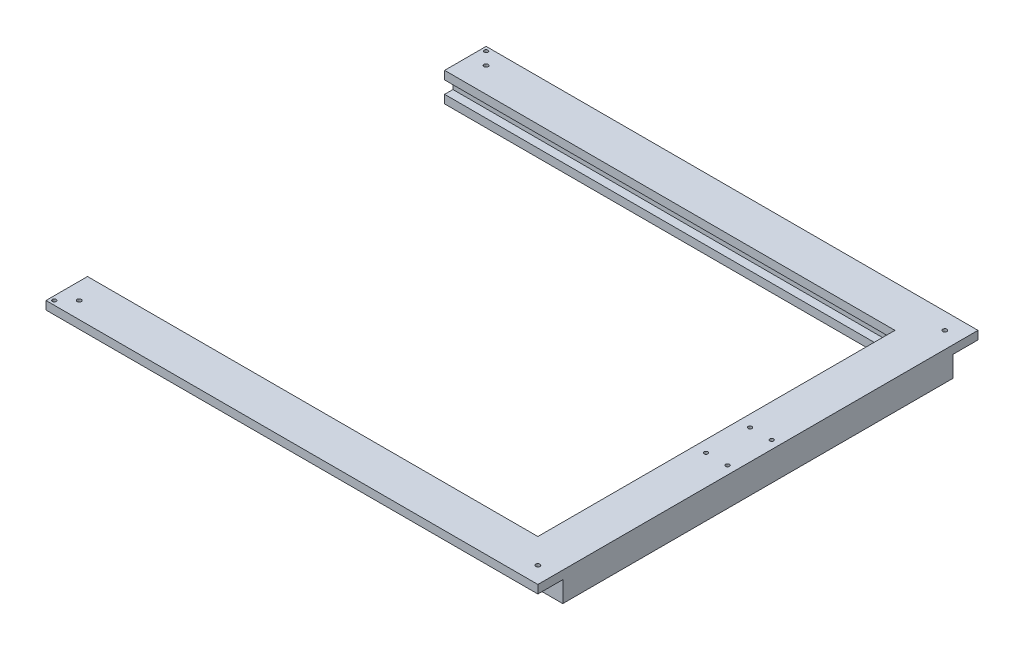
from build123d import *

# Parameters (mm, degrees)
EXTRUDE_2_DEPTH             = 10
EXTRUDE_3_DEPTH             = 15
SKETCH_4_R                  = 2.5
CUT_EXTRUDE_1_DEPTH         = 816.035490032
PATTERN_LINEAR_2_COUNT      = 2
PATTERN_LINEAR_2_PITCH      = 552.3
PATTERN_LINEAR_2_COUNT_DIR2 = 2
PATTERN_LINEAR_2_PITCH_DIR2 = 490
EXTRUDE_4_DEPTH             = 10
SKETCH_6_R                  = 2.25
CUT_EXTRUDE_2_DEPTH         = 816.403489085
SKETCH_7_R                  = 2.25
CUT_EXTRUDE_3_DEPTH         = 816.035490032


with BuildPart() as part:
    # Эскиз1 → Бобышка-Вытянуть2 (new body)
    with BuildSketch(Plane(origin=(0, 0, 0), x_dir=(1, 0, 0), z_dir=(0, 1, 0))):
        Polygon((50, -77.921508101), (50, -607.921508101), (-542.3, -607.921508101), (-542.3, -557.921508101), (0, -557.921508101), (0, -127.921508101), (-542.3, -127.921508101), (-542.3, -77.921508101), align=None)
    extrude(amount=EXTRUDE_2_DEPTH)

    # Эскиз2 → Бобышка-Вытянуть3 (add)
    with BuildSketch(Plane.XZ):
        Polygon((50, 577.921508101), (50, 107.921508101), (-542.3, 107.921508101), (-542.3, 117.921508101), (10, 117.921508101), (10, 567.921508101), (-542.3, 567.921508101), (-542.3, 577.921508101), align=None)
    extrude(amount=EXTRUDE_3_DEPTH)

    # Эскиз4 → Вырез-Вытянуть1 (cut, through all)
    with BuildSketch(Plane(origin=(0, 10, 0), x_dir=(1, 0, 0), z_dir=(0, 1, 0))):
        with Locations((-522.3, -97.921508101)):
            Circle(SKETCH_4_R)
    cut_extrude_1 = extrude(amount=-CUT_EXTRUDE_1_DEPTH, mode=Mode.SUBTRACT)

    # Линейный массив2: Cut-Extrude 1 2 × 2
    with Locations(*[(i * PATTERN_LINEAR_2_PITCH, 0, j * PATTERN_LINEAR_2_PITCH_DIR2) for i in range(PATTERN_LINEAR_2_COUNT) for j in range(PATTERN_LINEAR_2_COUNT_DIR2) if (i, j) != (0, 0)]):
        add(cut_extrude_1, mode=Mode.SUBTRACT)

    # Эскиз5 → Бобышка-Вытянуть4 (add)
    with BuildSketch(Plane.XZ.offset(15)):
        Polygon((50, 577.921508101), (-542.3, 577.921508101), (-542.3, 557.921508101), (0, 557.921508101), (0, 127.921508101), (-542.3, 127.921508101), (-542.3, 107.921508101), (50, 107.921508101), align=None)
    extrude(amount=EXTRUDE_4_DEPTH)

    # Эскиз6 → Вырез-Вытянуть2 (cut, through all)
    with BuildSketch(Plane.XZ.offset(25)):
        with Locations((14, 369.421508101)):
            Circle(SKETCH_6_R)
        with Locations((40, 369.421508101)):
            Circle(SKETCH_6_R)
        with Locations((40, 316.421508101)):
            Circle(SKETCH_6_R)
        with Locations((14, 316.421508101)):
            Circle(SKETCH_6_R)
    extrude(amount=-CUT_EXTRUDE_2_DEPTH, mode=Mode.SUBTRACT)

    # Эскиз7 → Вырез-Вытянуть3 (cut, through all)
    with BuildSketch(Plane.XZ):
        with Locations((-537.3, 602.921508101)):
            Circle(SKETCH_7_R)
        with Locations((-537.3, 82.921508101)):
            Circle(SKETCH_7_R)
    extrude(amount=-CUT_EXTRUDE_3_DEPTH, mode=Mode.SUBTRACT)


solid = part.part
